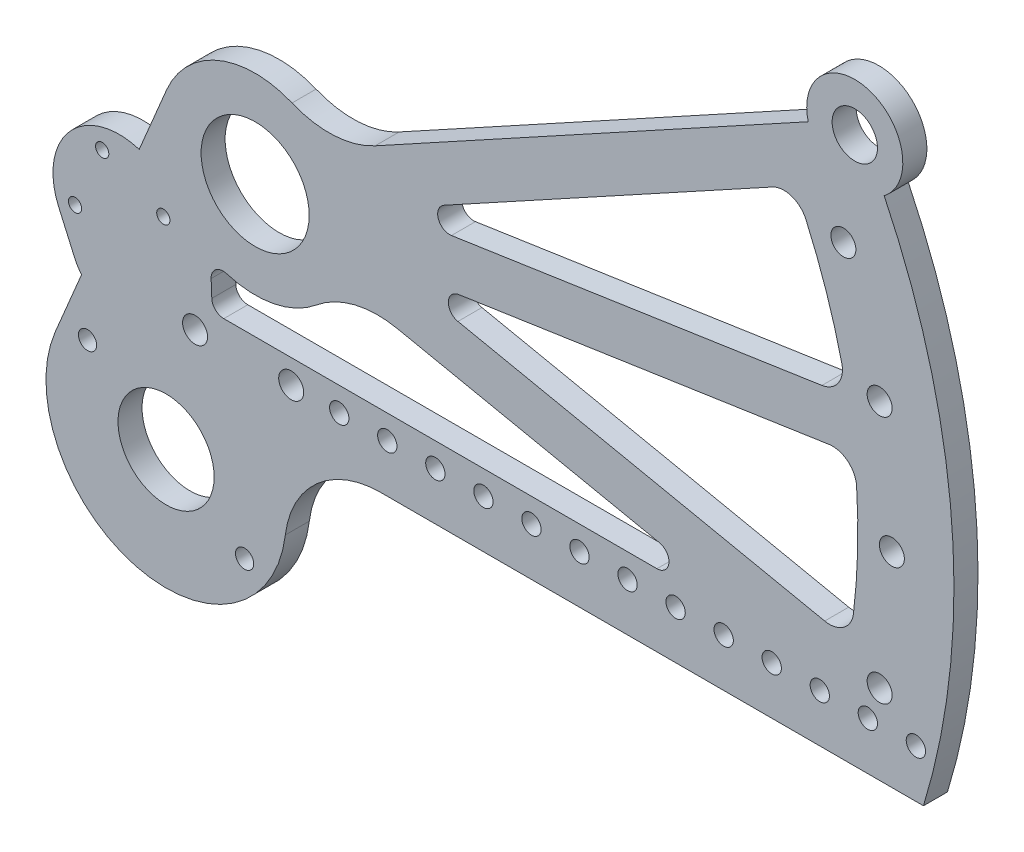
from build123d import *

# Parameters (mm, degrees)
SKETCH1_R           = 1.75
SKETCH1_R_2         = 3.302
SKETCH1_R_3         = 2.413
SKETCH1_R_4         = 12.7
SKETCH1_R_5         = 14.281149998
SKETCH1_R_6         = 2.5527
SKETCH1_R_7         = 5.9944
BOSS_EXTRUDE1_DEPTH = 6.35


with BuildPart() as part:
    # Sketch1 → Boss-Extrude1 (new body)
    with BuildSketch(Plane(origin=(0, 0, 0), x_dir=(-1, 0, 0), z_dir=(0, 0, -1))):
        with BuildLine():
            Line((-31.721738277, 24.629886735), (-146.170088384, 87.365400413))
            ThreePointArc((-146.170088384, 87.365400413), (-162.606044593, 102.518063532), (-166.242121917, 80.460801739))
            ThreePointArc((-166.242121917, 80.460801739), (-184.141380672, 14.224473287), (-176.626960261, -53.975))
            Line((-176.626960261, -53.975), (-33.194381935, -53.975))
            ThreePointArc((-33.194381935, -53.975), (-16.353189451, -60.360946363), (-7.980260895, -76.307737346))
            ThreePointArc((-7.980260895, -76.307737346), (31.676825474, -103.162616273), (52.812443226, -60.184078795))
            Line((52.812443226, -60.184078795), (45.859161931, -43.620642669))
            ThreePointArc((45.859161931, -43.620642669), (46.821980785, -42.387435085), (47.569931866, -41.013247954))
            Line((47.569931866, -41.013247954), (51.934565947, -31.139666326))
            ThreePointArc((51.934565947, -31.139666326), (48.962006062, -12.385946654), (30.645740354, -7.380696976))
            Line((30.645740354, -7.380696976), (23.420042255, 9.831664186))
            ThreePointArc((23.420042255, 9.831664186), (9.646239085, 23.497022608), (-9.756276385, 23.451547307))
            ThreePointArc((-9.756276385, 23.451547307), (-20.873181942, 21.53956394), (-31.721738277, 24.629886735))
        make_face()
        with Locations((40.421189912, -12.399445261)):
            Circle(SKETCH1_R, mode=Mode.SUBTRACT)
        with Locations((47.593474649, -28.556744901)):
            Circle(SKETCH1_R, mode=Mode.SUBTRACT)
        with Locations((15.875, -41.275)):
            Circle(SKETCH1_R_2, mode=Mode.SUBTRACT)
        with Locations((2.78154477, -87.114522117)):
            Circle(SKETCH1_R_3, mode=Mode.SUBTRACT)
        with Locations((44.293236039, -57.832795939)):
            Circle(SKETCH1_R_3, mode=Mode.SUBTRACT)
        with Locations((23.537390405, -72.473659028)):
            Circle(SKETCH1_R_4, mode=Mode.SUBTRACT)
        with Locations((-9.525, -41.275)):
            Circle(SKETCH1_R_2, mode=Mode.SUBTRACT)
        with Locations((-165.041643061, 32.828823937)):
            Circle(SKETCH1_R_2, mode=Mode.SUBTRACT)
        with Locations((-165.041643061, -32.828823938)):
            Circle(SKETCH1_R_2, mode=Mode.SUBTRACT)
        with Locations((-155.465828334, 64.396054582)):
            Circle(SKETCH1_R_2, mode=Mode.SUBTRACT)
        with Locations((-168.275000002, -1e-09)):
            Circle(SKETCH1_R_2, mode=Mode.SUBTRACT)
        with Locations((-2e-09, -1e-09)):
            Circle(SKETCH1_R_5, mode=Mode.SUBTRACT)
        with Locations((-174.625, -41.275)):
            Circle(SKETCH1_R_6, mode=Mode.SUBTRACT)
        with Locations((-161.925, -41.275)):
            Circle(SKETCH1_R_6, mode=Mode.SUBTRACT)
        with Locations((-149.225, -41.275)):
            Circle(SKETCH1_R_6, mode=Mode.SUBTRACT)
        with Locations((-136.525, -41.275)):
            Circle(SKETCH1_R_6, mode=Mode.SUBTRACT)
        with Locations((-123.825, -41.275)):
            Circle(SKETCH1_R_6, mode=Mode.SUBTRACT)
        with Locations((-111.125, -41.275)):
            Circle(SKETCH1_R_6, mode=Mode.SUBTRACT)
        with Locations((-98.425, -41.275)):
            Circle(SKETCH1_R_6, mode=Mode.SUBTRACT)
        with Locations((-73.025, -41.275)):
            Circle(SKETCH1_R_6, mode=Mode.SUBTRACT)
        with Locations((-85.725, -41.275)):
            Circle(SKETCH1_R_6, mode=Mode.SUBTRACT)
        with Locations((-60.325, -41.275)):
            Circle(SKETCH1_R_6, mode=Mode.SUBTRACT)
        with Locations((-47.625, -41.275)):
            Circle(SKETCH1_R_6, mode=Mode.SUBTRACT)
        with Locations((-34.925, -41.275)):
            Circle(SKETCH1_R_6, mode=Mode.SUBTRACT)
        with Locations((-22.225, -41.275)):
            Circle(SKETCH1_R_6, mode=Mode.SUBTRACT)
        with Locations((24.263890272, -19.571729998)):
            Circle(SKETCH1_R, mode=Mode.SUBTRACT)
        with Locations((-158.474943349, 90.50873372)):
            Circle(SKETCH1_R_7, mode=Mode.SUBTRACT)
        with BuildLine():
            Line((-136.7018524, 67.692461879), (-49.888483047, 20.105219989))
            ThreePointArc((-49.888483047, 20.105219989), (-48.40578749, 16.307419992), (-51.884293307, 14.180998537))
            Line((-51.884293307, 14.180998537), (-149.795684871, 28.825659386))
            ThreePointArc((-149.795684871, 28.825659386), (-154.113819123, 31.54467252), (-155.036811216, 36.563377676))
            ThreePointArc((-155.036811216, 36.563377676), (-150.953895829, 50.854840016), (-145.556679438, 64.703527647))
            ThreePointArc((-145.556679438, 64.703527647), (-141.785005521, 68.14064733), (-136.7018524, 67.692461879))
        make_face(mode=Mode.SUBTRACT)
        with BuildLine():
            Line((-106.835310381, -28.641149755), (-37.540069632, -14.270359918))
            ThreePointArc((-37.540069632, -14.270359918), (-26.262071615, -14.489518064), (-16.191119842, -19.57058094))
            ThreePointArc((-16.191119842, -19.57058094), (-4.929611011, -24.917041063), (7.519343103, -24.261481391))
            ThreePointArc((7.519343103, -24.261481391), (10.392776221, -24.775805222), (11.631809956, -27.41889854))
            Line((11.631809956, -27.41889854), (11.456624353, -31.874731975))
            ThreePointArc((11.456624353, -31.874731975), (10.484598164, -34.038738629), (8.284075388, -34.925))
            Line((8.284075388, -34.925), (-106.190581637, -34.925))
            ThreePointArc((-106.190581637, -34.925), (-109.349000904, -32.074056686), (-106.835310381, -28.641149755))
        make_face(mode=Mode.SUBTRACT)
        with BuildLine():
            Line((-151.674333159, 16.265377518), (-53.762941599, 1.62071667))
            ThreePointArc((-53.762941599, 1.62071667), (-51.058848917, -1.430439454), (-53.587874927, -4.628204042))
            Line((-53.587874927, -4.628204042), (-150.525780255, -24.731666411))
            ThreePointArc((-150.525780255, -24.731666411), (-155.517613032, -23.672930664), (-158.118539501, -19.282657626))
            ThreePointArc((-158.118539501, -19.282657626), (-159.227492405, -4.460838665), (-158.95010909, 10.399819206))
            ThreePointArc((-158.95010909, 10.399819206), (-156.599060705, 14.928824322), (-151.674333159, 16.265377518))
        make_face(mode=Mode.SUBTRACT)
    extrude(amount=-BOSS_EXTRUDE1_DEPTH)


solid = part.part
